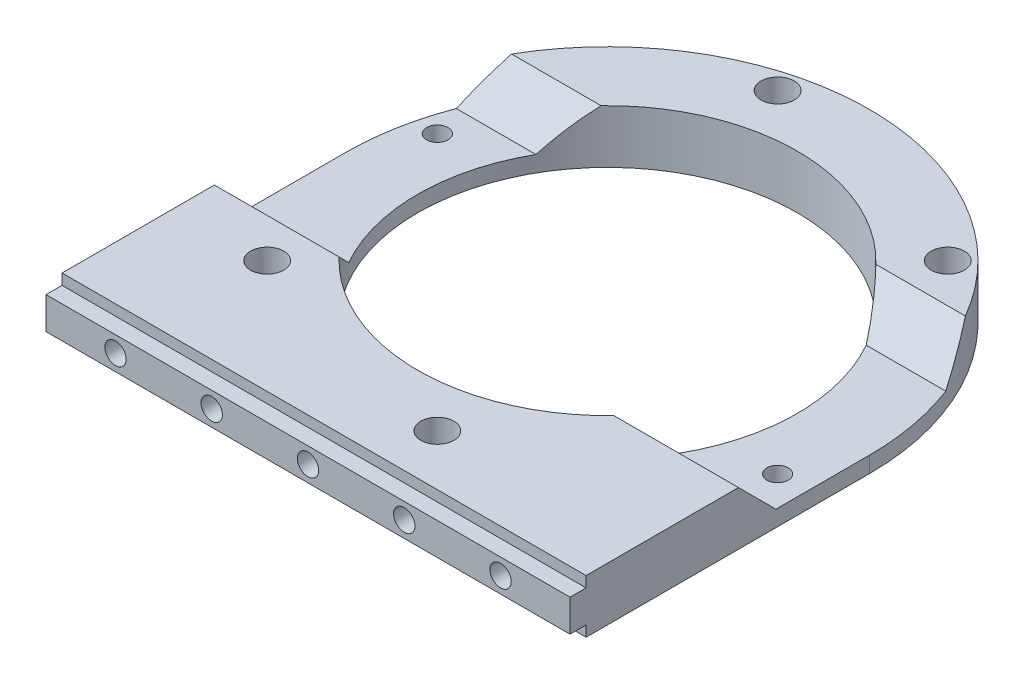
from build123d import *

# Parameters (mm, degrees)
SKETCH_1_R           = 35.5
SKETCH_1_R_2         = 2
EXTRUDE_4_DEPTH      = 10
SKETCH_24_W          = 98
SKETCH_24_H          = 6
EXTRUDE_5_DEPTH      = 3
SKETCH_26_W          = 98
SKETCH_26_H          = 35
CUT_EXTRUDE_17_DEPTH = 7
CHAMFER_1_SIZE       = 7
SKETCH_27_R          = 3.1
CUT_EXTRUDE_18_DEPTH = 5
SKETCH_28_R          = 2
CUT_EXTRUDE_19_DEPTH = 15


with BuildPart() as part:
    # 스케치1 → 보스-돌출4 (new body)
    with BuildSketch(Plane(origin=(0, 0, 0), x_dir=(1, 0, 0), z_dir=(0, 1, 0))):
        with BuildLine():
            Line((-49, 0), (-49, -53))
            Line((-49, -53), (49, -53))
            Line((49, -53), (49, 0))
            ThreePointArc((49, 0), (0, 49), (-49, 0))
        make_face()
        with Locations(Location((0, 0, 0), (0, 0, 270))):
            Circle(SKETCH_1_R, mode=Mode.SUBTRACT)
        with Locations(Location((-43.466662183, 11.64685703, 0), (0, 0, 270))):
            Circle(SKETCH_1_R_2, mode=Mode.SUBTRACT)
        with Locations(Location((-11.64685703, 43.466662183, 0), (0, 0, 270))):
            Circle(SKETCH_1_R_2, mode=Mode.SUBTRACT)
        with Locations(Location((31.819805153, 31.819805153, 0), (0, 0, 270))):
            Circle(SKETCH_1_R_2, mode=Mode.SUBTRACT)
        with Locations(Location((43.466662183, -11.64685703, 0), (0, 0, 270))):
            Circle(SKETCH_1_R_2, mode=Mode.SUBTRACT)
        with Locations(Location((11.64685703, -43.466662183, 0), (0, 0, 270))):
            Circle(SKETCH_1_R_2, mode=Mode.SUBTRACT)
        with Locations(Location((-31.819805153, -31.819805153, 0), (0, 0, 270))):
            Circle(SKETCH_1_R_2, mode=Mode.SUBTRACT)
    extrude(amount=EXTRUDE_4_DEPTH)

    # 스케치24 → 보스-돌출5 (add)
    with BuildSketch(Plane.XY.offset(53)):
        with Locations((0, 5)):
            Rectangle(SKETCH_24_W, SKETCH_24_H)
    extrude(amount=EXTRUDE_5_DEPTH)

    # 스케치26 → 컷-돌출17 (cut)
    with BuildSketch(Plane(origin=(0, 10, 0), x_dir=(1, 0, 0), z_dir=(0, 1, 0))):
        Rectangle(SKETCH_26_W, SKETCH_26_H)
    extrude(amount=-CUT_EXTRUDE_17_DEPTH, mode=Mode.SUBTRACT)

    # 모따기1
    chamfer_1_edges = [part.edges().sort_by_distance(p)[0] for p in [
        (-39.943445211, 10, 17.5),
        (39.943445211, 10, 17.5),
        (38.327664665, 10, -17.5),
        (-38.327664665, 10, -17.5),
    ]]
    chamfer(chamfer_1_edges, length=CHAMFER_1_SIZE - 0.0001)  # a hair under: the kernel refuses the full size

    # 스케치27 → 컷-돌출18 (cut)
    with BuildSketch(Plane(origin=(0, 10, 0), x_dir=(1, 0, 0), z_dir=(0, 1, 0))):
        with Locations(Location((-11.64685703, 43.466662183, 0), (0, 0, 270))):
            Circle(SKETCH_27_R)
        with Locations(Location((31.819805153, 31.819805153, 0), (0, 0, 270))):
            Circle(SKETCH_27_R)
        with Locations((43.466662183, -11.64685703)):
            Circle(SKETCH_27_R)
        with Locations(Location((11.64685703, -43.466662183, 0), (0, 0, 270))):
            Circle(SKETCH_27_R)
        with Locations(Location((-31.819805153, -31.819805153, 0), (0, 0, 270))):
            Circle(SKETCH_27_R)
        with Locations((-43.466662183, 11.64685703)):
            Circle(SKETCH_27_R)
    extrude(amount=-CUT_EXTRUDE_18_DEPTH, mode=Mode.SUBTRACT)

    # 스케치28 → 컷-돌출19 (cut)
    with BuildSketch(Plane.XY.offset(56)):
        with Locations((-36, 5)):
            Circle(SKETCH_28_R)
        with Locations((-18, 5)):
            Circle(SKETCH_28_R)
        with Locations((0, 5)):
            Circle(SKETCH_28_R)
        with Locations((18, 5)):
            Circle(SKETCH_28_R)
        with Locations((36, 5)):
            Circle(SKETCH_28_R)
    extrude(amount=-CUT_EXTRUDE_19_DEPTH, mode=Mode.SUBTRACT)


solid = part.part
